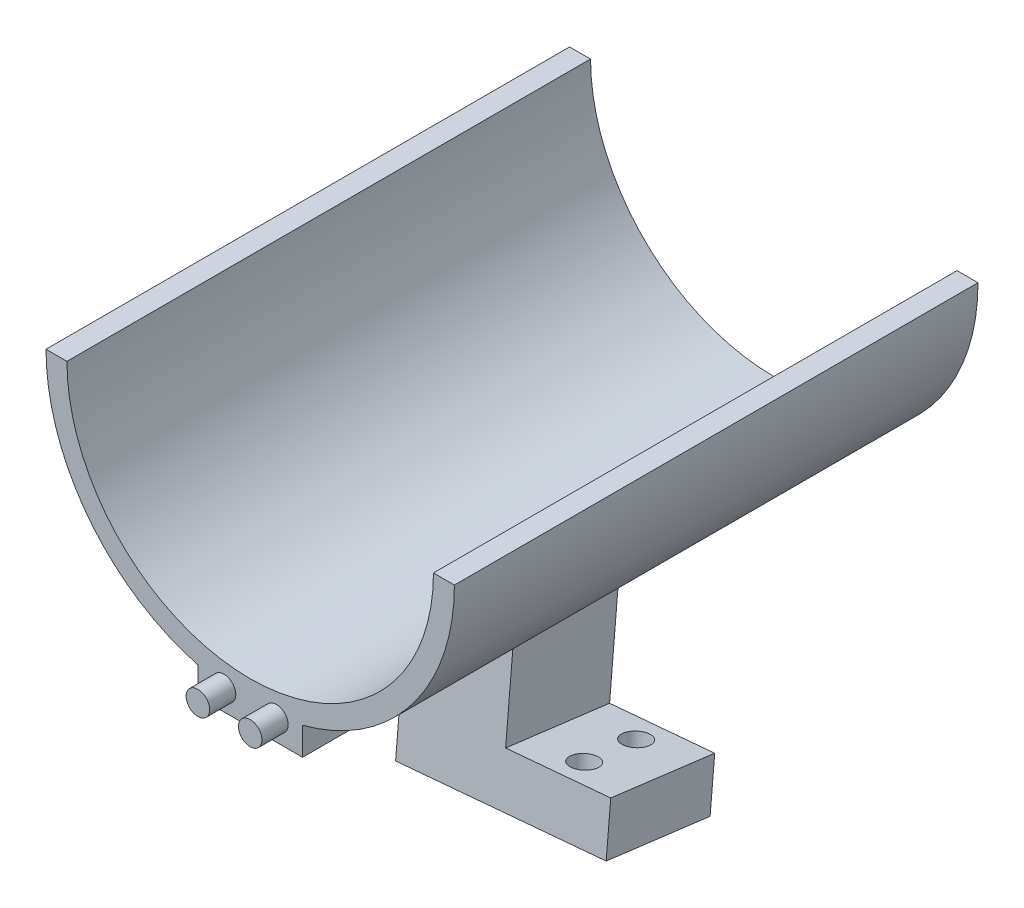
from build123d import *

# Parameters (mm, degrees)
EXTRUDE_THIN1_DEPTH       = 100
BOSS_EXTRUDE1_START       = -10
BOSS_EXTRUDE1_DEPTH       = 10
SKETCH3_R                 = 2.25
BOSS_EXTRUDE2_DEPTH       = 5
BOSS_EXTRUDE3_DEPTH       = 10
SKETCH5_R                 = 2.25
CUT_EXTRUDE1_DEPTH        = 6
BOSS_EXTRUDE4_REACH       = 121.416
BOSS_EXTRUDE4_END_RADIUS  = 39
SKETCH10_W                = 20
SKETCH10_H                = 20
BOSS_EXTRUDE5_START       = -26.86522245
BOSS_EXTRUDE5_OUTLINE_W   = 20
BOSS_EXTRUDE5_OUTLINE_H   = 20
BOSS_EXTRUDE5_DEPTH       = 26.86522245
BOSS_EXTRUDE5_START_2     = 78.671989238
BOSS_EXTRUDE5_2_OUTLINE_W = 23
BOSS_EXTRUDE5_2_OUTLINE_H = 23
BOSS_EXTRUDE5_2_DEPTH     = 3.328010762
BOSS_EXTRUDE6_DEPTH       = 20
SKETCH12_R                = 2.5
CUT_EXTRUDE2_DEPTH        = 20


with BuildPart() as part:
    # Sketch1 → Extrude-Thin1 (new body)
    with BuildSketch(Plane.XY):
        with BuildLine():
            ThreePointArc((-35, 0), (0, -35), (35, 0))
            Line((35, 0), (39, 0))
            ThreePointArc((39, 0), (0, -39), (-39, 0))
            Line((-39, 0), (-35, 0))
        make_face()
    extrude(amount=EXTRUDE_THIN1_DEPTH)

    # Sketch2 → Boss-Extrude1 (add)
    with BuildSketch(Plane.XY.offset(100).offset(BOSS_EXTRUDE1_START)):
        with BuildLine():
            Line((0, -39), (0, -35))
            Line((0, -35), (-10, -35))
            Line((-10, -35), (-10, -37.69615365))
            ThreePointArc((-10, -37.69615365), (-5.042321274, -38.672664715), (0, -39))
        make_face()
        with BuildLine():
            Line((10, -35), (0, -35))
            Line((0, -35), (0, -39))
            ThreePointArc((0, -39), (5.042321274, -38.672664715), (10, -37.69615365))
            Line((10, -37.69615365), (10, -35))
        make_face()
        with BuildLine():
            ThreePointArc((10, -37.69615365), (5.042321274, -38.672664715), (0, -39))
            ThreePointArc((0, -39), (-5.042321274, -38.672664715), (-10, -37.69615365))
            Line((-10, -37.69615365), (-10, -43))
            Line((-10, -43), (10, -43))
            Line((10, -43), (10, -37.69615365))
        make_face()
    extrude(amount=BOSS_EXTRUDE1_DEPTH)

    # Sketch3 → Boss-Extrude2 (add)
    with BuildSketch(Plane.XY.offset(100)):
        with Locations((-5, -39)):
            Circle(SKETCH3_R)
        with Locations((5, -39)):
            Circle(SKETCH3_R)
    extrude(amount=BOSS_EXTRUDE2_DEPTH)

    # Sketch4 → Boss-Extrude3 (add)
    with BuildSketch(Plane(origin=(0, 0, 0), x_dir=(-1, 0, 0), z_dir=(0, 0, -1))):
        with BuildLine():
            Line((0, -39), (0, -35))
            Line((0, -35), (-10, -35))
            Line((-10, -35), (-10, -37.69615365))
            ThreePointArc((-10, -37.69615365), (-5.042321274, -38.672664715), (0, -39))
        make_face()
        with BuildLine():
            ThreePointArc((10, -37.69615365), (5.042321274, -38.672664715), (0, -39))
            ThreePointArc((0, -39), (-5.042321274, -38.672664715), (-10, -37.69615365))
            Line((-10, -37.69615365), (-10, -43))
            Line((-10, -43), (10, -43))
            Line((10, -43), (10, -37.69615365))
        make_face()
        with BuildLine():
            Line((10, -35), (0, -35))
            Line((0, -35), (0, -39))
            ThreePointArc((0, -39), (5.042321274, -38.672664715), (10, -37.69615365))
            Line((10, -37.69615365), (10, -35))
        make_face()
    extrude(amount=-BOSS_EXTRUDE3_DEPTH)

    # Sketch5 → Cut-Extrude1 (cut)
    with BuildSketch(Plane(origin=(0, 0, 0), x_dir=(-1, 0, 0), z_dir=(0, 0, -1))):
        with Locations(Location((-5, -39, 0), (0, 0, 180))):
            Circle(SKETCH5_R)
        with Locations(Location((5, -39, 0), (0, 0, 180))):
            Circle(SKETCH5_R)
    extrude(amount=-CUT_EXTRUDE1_DEPTH, mode=Mode.SUBTRACT)

    # Boss-Extrude4: up to this cylinder (the profile starts outside it)
    boss_extrude4_end = Plane(origin=(0, 0, 50), z_dir=(0, 0, -1)) * Cylinder(BOSS_EXTRUDE4_END_RADIUS, 321.832, mode=Mode.PRIVATE)
    # Sketch10 → Boss-Extrude4 (add, up to the surface)
    with BuildSketch(Plane(origin=(0, -51.355775573, 4.493048169), x_dir=(1, 0, 0), z_dir=(0, 0.9961946980917462, -0.08715574274765152)), mode=Mode.PRIVATE) as boss_extrude4_sk1:
        with Locations((0, -45.680780994)):
            Rectangle(SKETCH10_W, SKETCH10_H)
    boss_extrude4_tool1 = extrude(boss_extrude4_sk1.sketch, amount=BOSS_EXTRUDE4_REACH, mode=Mode.PRIVATE) - boss_extrude4_end
    add(boss_extrude4_tool1.solids().sort_by_distance((0, -47.374433, 50))[0])

    # Boss-Extrude5: read off the stored shape, not the designer's step
    # Boss-Extrude5 outline → Boss-Extrude5 (add)
    with BuildSketch(Plane(origin=(0, -51.355775573, 4.493048169), x_dir=(1, 0, 0), z_dir=(0, 0.9961946980917462, -0.08715574274765152)).offset(BOSS_EXTRUDE5_START)):
        with Locations((0, -45.680780994)):
            Rectangle(BOSS_EXTRUDE5_OUTLINE_W, BOSS_EXTRUDE5_OUTLINE_H)
    extrude(amount=BOSS_EXTRUDE5_DEPTH)

    # Boss-Extrude5 2 outline → Boss-Extrude5 2 (cut)
    with BuildSketch(Plane(origin=(0, 0, 0), x_dir=(0.9966522374056315, 0.0811043240761468, -0.010315342480997098), z_dir=(0.08175767654690848, -0.9886876617314986, 0.12574732548071493)).offset(BOSS_EXTRUDE5_START_2)):
        with Locations((-6.5, 42.5)):
            Rectangle(BOSS_EXTRUDE5_2_OUTLINE_W, BOSS_EXTRUDE5_2_OUTLINE_H)
    extrude(amount=BOSS_EXTRUDE5_2_DEPTH, mode=Mode.SUBTRACT)

    # Sketch11 → Boss-Extrude6 (add, along a direction that is not the sketch's normal)
    with BuildSketch(Plane(origin=(10, 0, 0), x_dir=(0, 0, -1), z_dir=(1, 0, 0))):
        Polygon((-42.236409552, -73.373320758), (-41.361522917, -63.373320758), (-61.216981199, -60.847982502), (-62.091867834, -70.847982502), align=None)
    extrude(amount=BOSS_EXTRUDE6_DEPTH, dir=(0.9966471031139101, 0.08150889038642521, -0.007131103885419538))

    # Sketch12 → Cut-Extrude2 (cut)
    with BuildSketch(Plane(origin=(5.614716446, -67.898222027, 8.635709896), x_dir=(0.9966522374056316, 0.0811043240761468, -0.010315342480997105), z_dir=(-0.08175767654690848, 0.9886876617314987, -0.12574732548071463))):
        with Locations(Location((14.399910724, -38.067319735, 0), (0, 0, 270))):
            Circle(SKETCH12_R)
        with Locations(Location((14.399910724, -48.082676206, 0), (0, 0, 270))):
            Circle(SKETCH12_R)
    extrude(amount=-CUT_EXTRUDE2_DEPTH, mode=Mode.SUBTRACT)


solid = part.part
